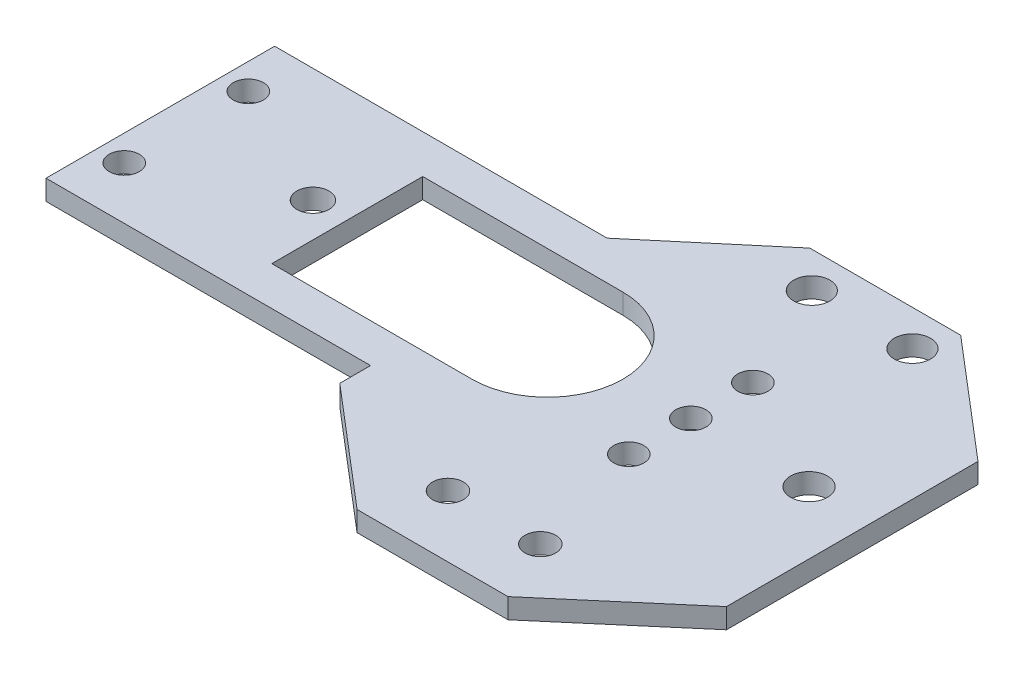
from build123d import *

# Parameters (mm, degrees)
CROQUIS1_R              = 1.53
CROQUIS1_R_2            = 1.837919526
CROQUIS1_R_3            = 1.597275243
CROQUIS1_R_4            = 1.5
SALIENTE_EXTRUIR1_DEPTH = 2
CROQUIS2_R              = 1.8
CORTAR_EXTRUIR1_DEPTH   = 10


with BuildPart() as part:
    # Croquis1 → Saliente-Extruir1 (new body)
    with BuildSketch(Plane(origin=(0, 0, 0), x_dir=(1, 0, 0), z_dir=(0, 1, 0))):
        Polygon((-26.514888395, -10.582637626), (-26.514888395, -7.527182045), (-40.886979894, -7.527182045), (-58.77250276, -7.527182045), (-58.77250276, 15.200062733), (-41.405808266, 15.200062733), (-25.724953766, 15.200062733), (-14.794888395, 24.417362374), (0.205111605, 24.417362374), (11.925111605, 14.417362374), (11.925111605, -10.582637626), (0.205111605, -20.582637626), (-14.794888395, -20.582637626), align=None)
        with Locations((-11.884888395, -14.457637626)):
            Circle(CROQUIS1_R, mode=Mode.SUBTRACT)
        with Locations((-2.704888395, -14.457637626)):
            Circle(CROQUIS1_R, mode=Mode.SUBTRACT)
        with Locations((5.705111605, 3.842362374)):
            Circle(CROQUIS1_R_2, mode=Mode.SUBTRACT)
        with Locations((-43.610544187, 3.842362374)):
            Circle(CROQUIS1_R_3, mode=Mode.SUBTRACT)
        with Locations((-6.044888395, 3.842362374)):
            Circle(CROQUIS1_R_4, mode=Mode.SUBTRACT)
        with Locations((-6.044888395, 10.008584025)):
            Circle(CROQUIS1_R_4, mode=Mode.SUBTRACT)
        with Locations((-6.044888395, -2.323859276)):
            Circle(CROQUIS1_R_4, mode=Mode.SUBTRACT)
        with Locations((-56.194888395, 10.008584025)):
            Circle(CROQUIS1_R_4, mode=Mode.SUBTRACT)
        with Locations((-56.194888395, -2.323859276)):
            Circle(CROQUIS1_R_4, mode=Mode.SUBTRACT)
        with BuildLine():
            Line((-40.195554385, 11.342362374), (-20.294888395, 11.342362374))
            ThreePointArc((-20.294888395, 11.342362374), (-12.794888395, 3.842362374), (-20.294888395, -3.657637626))
            Line((-20.294888395, -3.657637626), (-40.195554385, -3.657637626))
            Line((-40.195554385, -3.657637626), (-40.195554385, 11.342362374))
        make_face(mode=Mode.SUBTRACT)
    extrude(amount=SALIENTE_EXTRUIR1_DEPTH)

    # Croquis2 → Cortar-Extruir1 (cut)
    with BuildSketch(Plane(origin=(0, 2, 0), x_dir=(1, 0, 0), z_dir=(0, 1, 0))):
        with Locations((-11.039224955, 20.862391136)):
            Circle(CROQUIS2_R)
        with Locations((-1.039224955, 20.862391136)):
            Circle(CROQUIS2_R)
    extrude(amount=-CORTAR_EXTRUIR1_DEPTH, mode=Mode.SUBTRACT)


solid = part.part
